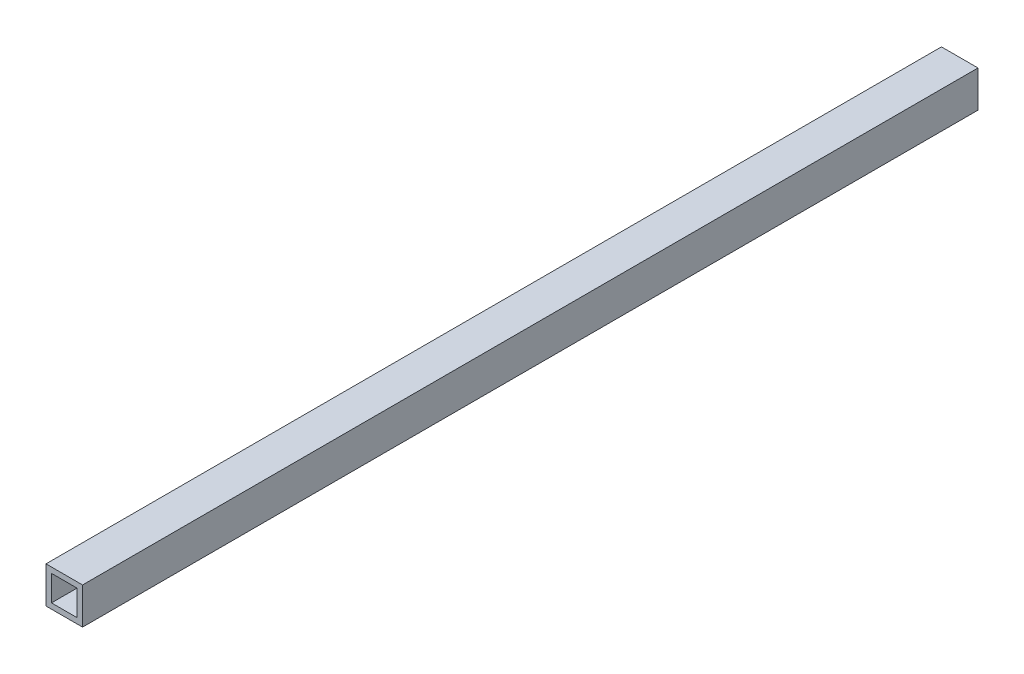
from build123d import *

# Parameters (mm, degrees)
SKETCH_1_W          = 20
SKETCH_1_H          = 20
EXTRUDE_1_DEPTH     = 490
SKETCH_2_W          = 14
SKETCH_2_H          = 14
CUT_EXTRUDE_1_DEPTH = 491.239648604


with BuildPart() as part:
    # 草图1 → 凸台-拉伸1 (new body)
    with BuildSketch(Plane.XY):
        with Locations((0.666666667, 1.006147649)):
            Rectangle(SKETCH_1_W, SKETCH_1_H)
    extrude(amount=EXTRUDE_1_DEPTH)

    # 草图2 → 切除-拉伸1 (cut, through all)
    with BuildSketch(Plane(origin=(0, 0, 0), x_dir=(-1, 0, 0), z_dir=(0, 0, -1))):
        with Locations((-0.666666667, 1.006147649)):
            Rectangle(SKETCH_2_W, SKETCH_2_H)
    extrude(amount=-CUT_EXTRUDE_1_DEPTH, mode=Mode.SUBTRACT)


solid = part.part
